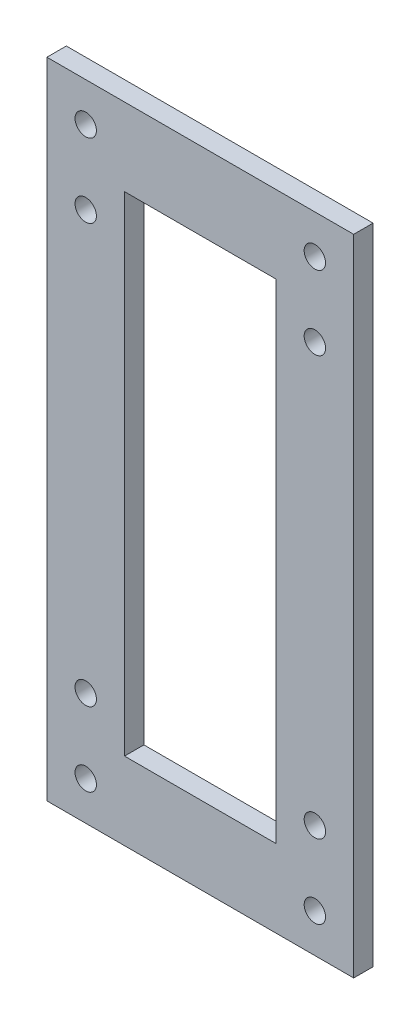
from build123d import *

# Parameters (mm, degrees)
SKETCH1_W           = 100.4
SKETCH1_H           = 210.8
SKETCH1_W_2         = 49.6
SKETCH1_H_2         = 160
BOSS_EXTRUDE1_DEPTH = 6.35
SKETCH2_R           = 3.5
CUT_EXTRUDE1_DEPTH  = 6.35
SKETCH3_R           = 3.5
CUT_EXTRUDE2_DEPTH  = 10


with BuildPart() as part:
    # Sketch1 → Boss-Extrude1 (new body)
    with BuildSketch(Plane.XY):
        with Locations((50.2, 105.4)):
            Rectangle(SKETCH1_W, SKETCH1_H)
        with Locations((50.2, 105.4)):
            Rectangle(SKETCH1_W_2, SKETCH1_H_2, mode=Mode.SUBTRACT)
    extrude(amount=BOSS_EXTRUDE1_DEPTH)

    # Sketch2 → Cut-Extrude1 (cut)
    with BuildSketch(Plane.XY.offset(6.35)):
        with Locations((12.70273435, 198.1)):
            Circle(SKETCH2_R)
        with Locations((87.69726565, 198.1)):
            Circle(SKETCH2_R)
        with Locations((87.69726565, 12.7)):
            Circle(SKETCH2_R)
        with Locations((12.70273435, 12.7)):
            Circle(SKETCH2_R)
    extrude(amount=-CUT_EXTRUDE1_DEPTH, mode=Mode.SUBTRACT)

    # Sketch3 → Cut-Extrude2 (cut)
    with BuildSketch(Plane.XY.offset(6.35)):
        with Locations((12.7, 173.9)):
            Circle(SKETCH3_R)
        with Locations((87.7, 173.9)):
            Circle(SKETCH3_R)
        with Locations((87.7, 36.9)):
            Circle(SKETCH3_R)
        with Locations((12.7, 36.9)):
            Circle(SKETCH3_R)
    extrude(amount=-CUT_EXTRUDE2_DEPTH, mode=Mode.SUBTRACT)


solid = part.part
